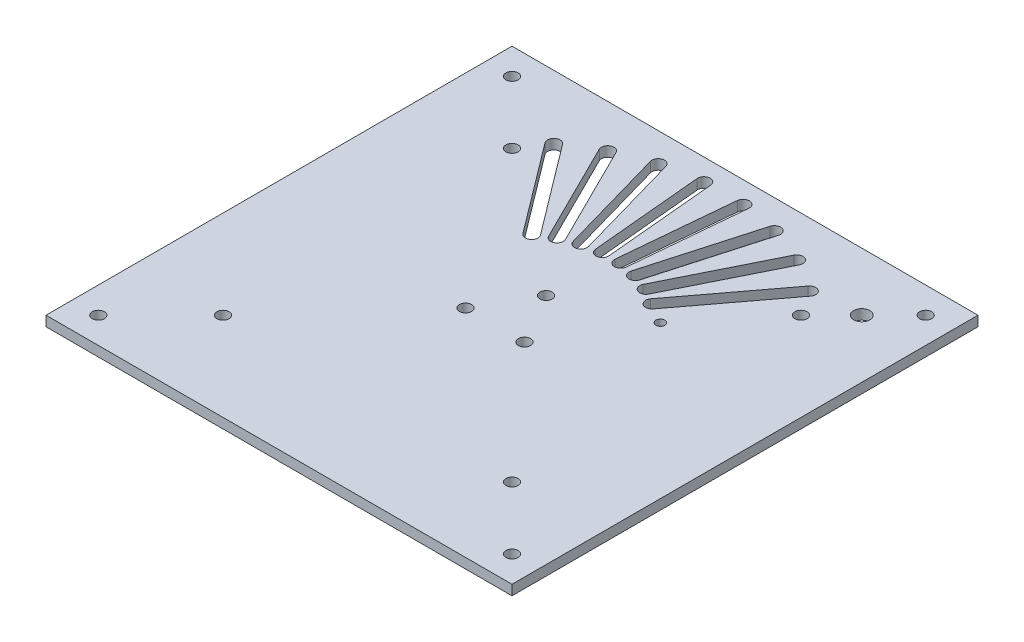
from build123d import *

# Parameters (mm, degrees)
SKETCH2_W                 = 130
SKETCH2_H                 = 130
BOSS_EXTRUDE1_DEPTH       = 2.8
CUT_EXTRUDE1_REACH        = 93.967
SKETCH4_R                 = 1.7
CUT_EXTRUDE2_REACH        = 93.967
SKETCH6_R                 = 1.7
CUT_EXTRUDE3_REACH        = 93.967
SKETCH8_R                 = 1.7
PRIMARY_WIRE_HOLE_REACH   = 93.967
SKETCH9_R                 = 2.25
SECONDARY_WIRE_HOLE_REACH = 93.967
SKETCH10_R                = 1.25
CUT_EXTRUDE6_REACH        = 93.967


with BuildPart() as part:
    # Sketch2 → Boss-Extrude1 (new body)
    with BuildSketch(Plane(origin=(0, 0, 0), x_dir=(1, 0, 0), z_dir=(0, 1, 0))):
        Rectangle(SKETCH2_W, SKETCH2_H)
    extrude(amount=BOSS_EXTRUDE1_DEPTH)

    # Sketch4 → Cut-Extrude1 (cut, up to next)
    with BuildSketch(Plane(origin=(0, 2.8, 0), x_dir=(1, 0, 0), z_dir=(0, 1, 0)), mode=Mode.PRIVATE) as cut_extrude1_sk1:
        with Locations((-57.7, 57.7)):
            Circle(SKETCH4_R)
    cut_extrude1_tool1 = extrude(cut_extrude1_sk1.sketch, amount=-CUT_EXTRUDE1_REACH, mode=Mode.PRIVATE) & part.part
    # Sketch4 → Cut-Extrude1 (cut, up to next)
    with BuildSketch(Plane(origin=(0, 2.8, 0), x_dir=(1, 0, 0), z_dir=(0, 1, 0)), mode=Mode.PRIVATE) as cut_extrude1_sk2:
        with Locations((57.7, 57.7)):
            Circle(SKETCH4_R)
    cut_extrude1_tool2 = extrude(cut_extrude1_sk2.sketch, amount=-CUT_EXTRUDE1_REACH, mode=Mode.PRIVATE) & part.part
    # Sketch4 → Cut-Extrude1 (cut, up to next)
    with BuildSketch(Plane(origin=(0, 2.8, 0), x_dir=(1, 0, 0), z_dir=(0, 1, 0)), mode=Mode.PRIVATE) as cut_extrude1_sk3:
        with Locations((57.7, -57.7)):
            Circle(SKETCH4_R)
    cut_extrude1_tool3 = extrude(cut_extrude1_sk3.sketch, amount=-CUT_EXTRUDE1_REACH, mode=Mode.PRIVATE) & part.part
    # Sketch4 → Cut-Extrude1 (cut, up to next)
    with BuildSketch(Plane(origin=(0, 2.8, 0), x_dir=(1, 0, 0), z_dir=(0, 1, 0)), mode=Mode.PRIVATE) as cut_extrude1_sk4:
        with Locations((-57.7, -57.7)):
            Circle(SKETCH4_R)
    cut_extrude1_tool4 = extrude(cut_extrude1_sk4.sketch, amount=-CUT_EXTRUDE1_REACH, mode=Mode.PRIVATE) & part.part
    add(cut_extrude1_tool1.solids().sort_by_distance((-57.7, 2.8, -57.7))[0], mode=Mode.SUBTRACT)
    add(cut_extrude1_tool2.solids().sort_by_distance((57.7, 2.8, -57.7))[0], mode=Mode.SUBTRACT)
    add(cut_extrude1_tool3.solids().sort_by_distance((57.7, 2.8, 57.7))[0], mode=Mode.SUBTRACT)
    add(cut_extrude1_tool4.solids().sort_by_distance((-57.7, 2.8, 57.7))[0], mode=Mode.SUBTRACT)

    # Sketch6 → Cut-Extrude2 (cut, up to next)
    with BuildSketch(Plane(origin=(0, 2.8, 0), x_dir=(1, 0, 0), z_dir=(0, 1, 0)), mode=Mode.PRIVATE) as cut_extrude2_sk1:
        with Locations((-40.305086528, 40.305086528)):
            Circle(SKETCH6_R)
    cut_extrude2_tool1 = extrude(cut_extrude2_sk1.sketch, amount=-CUT_EXTRUDE2_REACH, mode=Mode.PRIVATE) & part.part
    # Sketch6 → Cut-Extrude2 (cut, up to next)
    with BuildSketch(Plane(origin=(0, 2.8, 0), x_dir=(1, 0, 0), z_dir=(0, 1, 0)), mode=Mode.PRIVATE) as cut_extrude2_sk2:
        with Locations((40.305086528, 40.305086528)):
            Circle(SKETCH6_R)
    cut_extrude2_tool2 = extrude(cut_extrude2_sk2.sketch, amount=-CUT_EXTRUDE2_REACH, mode=Mode.PRIVATE) & part.part
    # Sketch6 → Cut-Extrude2 (cut, up to next)
    with BuildSketch(Plane(origin=(0, 2.8, 0), x_dir=(1, 0, 0), z_dir=(0, 1, 0)), mode=Mode.PRIVATE) as cut_extrude2_sk3:
        with Locations((40.305086528, -40.305086528)):
            Circle(SKETCH6_R)
    cut_extrude2_tool3 = extrude(cut_extrude2_sk3.sketch, amount=-CUT_EXTRUDE2_REACH, mode=Mode.PRIVATE) & part.part
    # Sketch6 → Cut-Extrude2 (cut, up to next)
    with BuildSketch(Plane(origin=(0, 2.8, 0), x_dir=(1, 0, 0), z_dir=(0, 1, 0)), mode=Mode.PRIVATE) as cut_extrude2_sk4:
        with Locations((-40.305086528, -40.305086528)):
            Circle(SKETCH6_R)
    cut_extrude2_tool4 = extrude(cut_extrude2_sk4.sketch, amount=-CUT_EXTRUDE2_REACH, mode=Mode.PRIVATE) & part.part
    add(cut_extrude2_tool1.solids().sort_by_distance((-40.305087, 2.8, -40.305087))[0], mode=Mode.SUBTRACT)
    add(cut_extrude2_tool2.solids().sort_by_distance((40.305087, 2.8, -40.305087))[0], mode=Mode.SUBTRACT)
    add(cut_extrude2_tool3.solids().sort_by_distance((40.305087, 2.8, 40.305087))[0], mode=Mode.SUBTRACT)
    add(cut_extrude2_tool4.solids().sort_by_distance((-40.305087, 2.8, 40.305087))[0], mode=Mode.SUBTRACT)

    # Sketch8 → Cut-Extrude3 (cut, up to next)
    with BuildSketch(Plane(origin=(0, 2.8, 0), x_dir=(1, 0, 0), z_dir=(0, 1, 0)), mode=Mode.PRIVATE) as cut_extrude3_sk1:
        with Locations((0, 9.5)):
            Circle(SKETCH8_R)
    cut_extrude3_tool1 = extrude(cut_extrude3_sk1.sketch, amount=-CUT_EXTRUDE3_REACH, mode=Mode.PRIVATE) & part.part
    # Sketch8 → Cut-Extrude3 (cut, up to next)
    with BuildSketch(Plane(origin=(0, 2.8, 0), x_dir=(1, 0, 0), z_dir=(0, 1, 0)), mode=Mode.PRIVATE) as cut_extrude3_sk2:
        with Locations((8.227241336, -4.75)):
            Circle(SKETCH8_R)
    cut_extrude3_tool2 = extrude(cut_extrude3_sk2.sketch, amount=-CUT_EXTRUDE3_REACH, mode=Mode.PRIVATE) & part.part
    # Sketch8 → Cut-Extrude3 (cut, up to next)
    with BuildSketch(Plane(origin=(0, 2.8, 0), x_dir=(1, 0, 0), z_dir=(0, 1, 0)), mode=Mode.PRIVATE) as cut_extrude3_sk3:
        with Locations((-8.227241336, -4.75)):
            Circle(SKETCH8_R)
    cut_extrude3_tool3 = extrude(cut_extrude3_sk3.sketch, amount=-CUT_EXTRUDE3_REACH, mode=Mode.PRIVATE) & part.part
    add(cut_extrude3_tool1.solids().sort_by_distance((0, 2.8, -9.5))[0], mode=Mode.SUBTRACT)
    add(cut_extrude3_tool2.solids().sort_by_distance((8.227241, 2.8, 4.75))[0], mode=Mode.SUBTRACT)
    add(cut_extrude3_tool3.solids().sort_by_distance((-8.227241, 2.8, 4.75))[0], mode=Mode.SUBTRACT)

    # Sketch9 → Primary wire hole (cut, up to next)
    with BuildSketch(Plane(origin=(0, 2.8, 0), x_dir=(1, 0, 0), z_dir=(0, 1, 0)), mode=Mode.PRIVATE) as primary_wire_hole_sk1:
        with Locations((48.790367902, 48.790367902)):
            Circle(SKETCH9_R)
    primary_wire_hole_tool1 = extrude(primary_wire_hole_sk1.sketch, amount=-PRIMARY_WIRE_HOLE_REACH, mode=Mode.PRIVATE) & part.part
    add(primary_wire_hole_tool1.solids().sort_by_distance((48.790368, 2.8, -48.790368))[0], mode=Mode.SUBTRACT)

    # Sketch10 → Secondary wire hole (cut, up to next)
    with BuildSketch(Plane(origin=(0, 2.8, 0), x_dir=(1, 0, 0), z_dir=(0, 1, 0)), mode=Mode.PRIVATE) as secondary_wire_hole_sk1:
        with Locations((22.506385739, 18.885099973)):
            Circle(SKETCH10_R)
    secondary_wire_hole_tool1 = extrude(secondary_wire_hole_sk1.sketch, amount=-SECONDARY_WIRE_HOLE_REACH, mode=Mode.PRIVATE) & part.part
    add(secondary_wire_hole_tool1.solids().sort_by_distance((22.506386, 2.8, -18.8851))[0], mode=Mode.SUBTRACT)

    # Sketch11 → Cut-Extrude6 (cut, up to next)
    with BuildSketch(Plane(origin=(0, 2.8, 0), x_dir=(1, 0, 0), z_dir=(0, 1, 0)), mode=Mode.PRIVATE) as cut_extrude6_sk1:
        with BuildLine():
            Line((-34.259927979, 48.372330261), (-15.380990703, 23.319134311))
            ThreePointArc((-15.380990703, 23.319134311), (-15.725426555, 20.868345878), (-18.176214988, 21.21278173))
            Line((-18.176214988, 21.21278173), (-37.055152264, 46.26597768))
            ThreePointArc((-37.055152264, 46.26597768), (-36.710716412, 48.716766113), (-34.259927979, 48.372330261))
        make_face()
    cut_extrude6_tool1 = extrude(cut_extrude6_sk1.sketch, amount=-CUT_EXTRUDE6_REACH, mode=Mode.PRIVATE) & part.part
    # Sketch11 → Cut-Extrude6 (cut, up to next)
    with BuildSketch(Plane(origin=(0, 2.8, 0), x_dir=(1, 0, 0), z_dir=(0, 1, 0)), mode=Mode.PRIVATE) as cut_extrude6_sk2:
        with BuildLine():
            Line((-27.938203096, 52.278884913), (-13.975987518, 24.187365977))
            ThreePointArc((-13.975987518, 24.187365977), (-11.629987027, 23.399151731), (-10.841772782, 25.745152222))
            Line((-10.841772782, 25.745152222), (-24.80398836, 53.836671159))
            ThreePointArc((-24.80398836, 53.836671159), (-27.149988851, 54.624885404), (-27.938203096, 52.278884913))
        make_face()
    cut_extrude6_tool2 = extrude(cut_extrude6_sk2.sketch, amount=-CUT_EXTRUDE6_REACH, mode=Mode.PRIVATE) & part.part
    # Sketch11 → Cut-Extrude6 (cut, up to next)
    with BuildSketch(Plane(origin=(0, 2.8, 0), x_dir=(1, 0, 0), z_dir=(0, 1, 0)), mode=Mode.PRIVATE) as cut_extrude6_sk3:
        with BuildLine():
            Line((-17.87286129, 56.517128637), (-9.301329978, 26.340883824))
            ThreePointArc((-9.301329978, 26.340883824), (-7.139754963, 25.135647974), (-5.934519112, 27.297222989))
            Line((-5.934519112, 27.297222989), (-14.506050425, 57.473467801))
            ThreePointArc((-14.506050425, 57.473467801), (-16.667625439, 58.678703651), (-17.87286129, 56.517128637))
        make_face()
    cut_extrude6_tool3 = extrude(cut_extrude6_sk3.sketch, amount=-CUT_EXTRUDE6_REACH, mode=Mode.PRIVATE) & part.part
    # Sketch11 → Cut-Extrude6 (cut, up to next)
    with BuildSketch(Plane(origin=(0, 2.8, 0), x_dir=(1, 0, 0), z_dir=(0, 1, 0)), mode=Mode.PRIVATE) as cut_extrude6_sk4:
        with BuildLine():
            Line((-7.200805802, 58.836837065), (-4.310928692, 27.600231771))
            ThreePointArc((-4.310928692, 27.600231771), (-2.407156164, 26.018887355), (-0.825811748, 27.922659883))
            Line((-0.825811748, 27.922659883), (-3.715688858, 59.159265177))
            ThreePointArc((-3.715688858, 59.159265177), (-5.619461386, 60.740609593), (-7.200805802, 58.836837065))
        make_face()
    cut_extrude6_tool4 = extrude(cut_extrude6_sk4.sketch, amount=-CUT_EXTRUDE6_REACH, mode=Mode.PRIVATE) & part.part
    # Sketch11 → Cut-Extrude6 (cut, up to next)
    with BuildSketch(Plane(origin=(0, 2.8, 0), x_dir=(1, 0, 0), z_dir=(0, 1, 0)), mode=Mode.PRIVATE) as cut_extrude6_sk5:
        with BuildLine():
            Line((3.715688858, 59.159265177), (0.825811748, 27.922659883))
            ThreePointArc((0.825811748, 27.922659883), (2.407156164, 26.018887355), (4.310928692, 27.600231771))
            Line((4.310928692, 27.600231771), (7.200805802, 58.836837065))
            ThreePointArc((7.200805802, 58.836837065), (5.619461386, 60.740609593), (3.715688858, 59.159265177))
        make_face()
    cut_extrude6_tool5 = extrude(cut_extrude6_sk5.sketch, amount=-CUT_EXTRUDE6_REACH, mode=Mode.PRIVATE) & part.part
    # Sketch11 → Cut-Extrude6 (cut, up to next)
    with BuildSketch(Plane(origin=(0, 2.8, 0), x_dir=(1, 0, 0), z_dir=(0, 1, 0)), mode=Mode.PRIVATE) as cut_extrude6_sk6:
        with BuildLine():
            Line((14.506050425, 57.473467801), (5.934519112, 27.297222989))
            ThreePointArc((5.934519112, 27.297222989), (7.139754963, 25.135647974), (9.301329978, 26.340883824))
            Line((9.301329978, 26.340883824), (17.87286129, 56.517128637))
            ThreePointArc((17.87286129, 56.517128637), (16.667625439, 58.678703651), (14.506050425, 57.473467801))
        make_face()
    cut_extrude6_tool6 = extrude(cut_extrude6_sk6.sketch, amount=-CUT_EXTRUDE6_REACH, mode=Mode.PRIVATE) & part.part
    # Sketch11 → Cut-Extrude6 (cut, up to next)
    with BuildSketch(Plane(origin=(0, 2.8, 0), x_dir=(1, 0, 0), z_dir=(0, 1, 0)), mode=Mode.PRIVATE) as cut_extrude6_sk7:
        with BuildLine():
            Line((24.80398836, 53.836671159), (10.841772782, 25.745152222))
            ThreePointArc((10.841772782, 25.745152222), (11.629987027, 23.399151731), (13.975987518, 24.187365977))
            Line((13.975987518, 24.187365977), (27.938203096, 52.278884913))
            ThreePointArc((27.938203096, 52.278884913), (27.149988851, 54.624885404), (24.80398836, 53.836671159))
        make_face()
    cut_extrude6_tool7 = extrude(cut_extrude6_sk7.sketch, amount=-CUT_EXTRUDE6_REACH, mode=Mode.PRIVATE) & part.part
    # Sketch11 → Cut-Extrude6 (cut, up to next)
    with BuildSketch(Plane(origin=(0, 2.8, 0), x_dir=(1, 0, 0), z_dir=(0, 1, 0)), mode=Mode.PRIVATE) as cut_extrude6_sk8:
        with BuildLine():
            Line((34.259927979, 48.372330261), (15.380990703, 23.319134311))
            ThreePointArc((15.380990703, 23.319134311), (15.725426555, 20.868345878), (18.176214988, 21.21278173))
            Line((18.176214988, 21.21278173), (37.055152264, 46.26597768))
            ThreePointArc((37.055152264, 46.26597768), (36.710716412, 48.716766113), (34.259927979, 48.372330261))
        make_face()
    cut_extrude6_tool8 = extrude(cut_extrude6_sk8.sketch, amount=-CUT_EXTRUDE6_REACH, mode=Mode.PRIVATE) & part.part
    add(cut_extrude6_tool1.solids().sort_by_distance((-26.218071, 2.8, -34.792556))[0], mode=Mode.SUBTRACT)
    add(cut_extrude6_tool2.solids().sort_by_distance((-19.389988, 2.8, -39.012019))[0], mode=Mode.SUBTRACT)
    add(cut_extrude6_tool3.solids().sort_by_distance((-11.90369, 2.8, -41.907176))[0], mode=Mode.SUBTRACT)
    add(cut_extrude6_tool4.solids().sort_by_distance((-4.013309, 2.8, -43.379748))[0], mode=Mode.SUBTRACT)
    add(cut_extrude6_tool5.solids().sort_by_distance((4.013309, 2.8, -43.379748))[0], mode=Mode.SUBTRACT)
    add(cut_extrude6_tool6.solids().sort_by_distance((11.90369, 2.8, -41.907176))[0], mode=Mode.SUBTRACT)
    add(cut_extrude6_tool7.solids().sort_by_distance((19.389988, 2.8, -39.012019))[0], mode=Mode.SUBTRACT)
    add(cut_extrude6_tool8.solids().sort_by_distance((26.218071, 2.8, -34.792556))[0], mode=Mode.SUBTRACT)


solid = part.part
